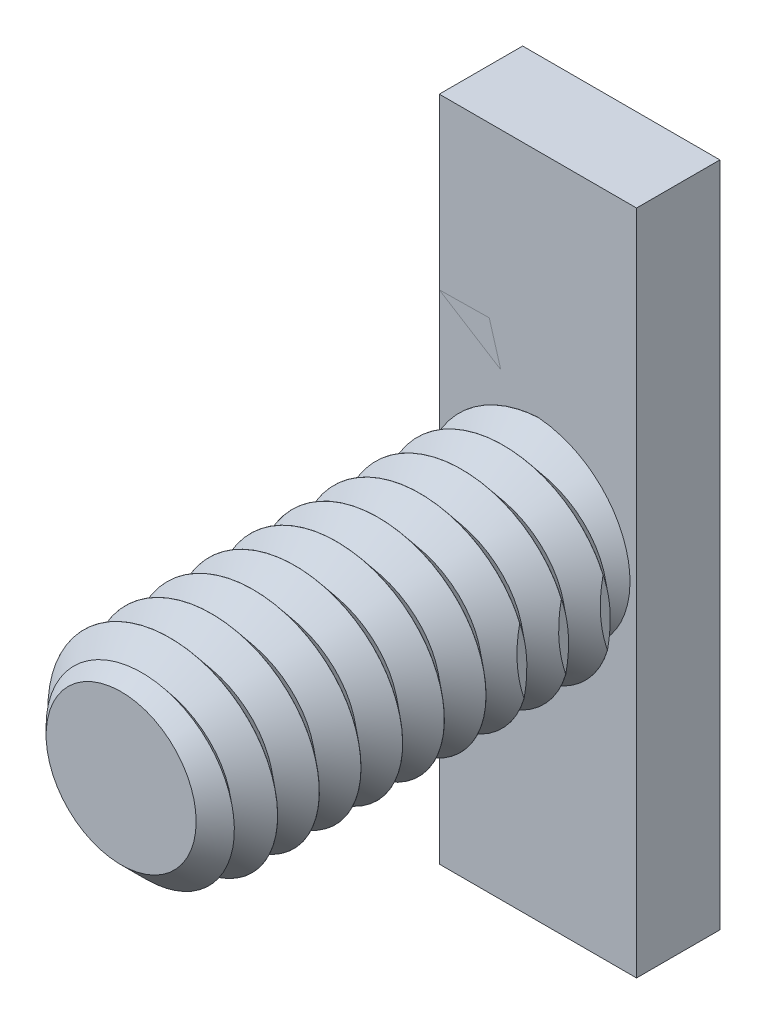
from build123d import *

# Parameters (mm, degrees)
BOSS_EXTRUDE1_DEPTH = 4
SKETCH2_R           = 5
BOSS_EXTRUDE2_DEPTH = 20
CHAMFER1_SIZE       = 1.4
CUT_SWEEP1_PITCH    = 2
BOSS_EXTRUDE3_DEPTH = 4
SKETCH23_W          = 4
SKETCH23_H          = 31.99837251
BOSS_EXTRUDE4_DEPTH = 4.732434
SKETCH26_W          = 9.464868598
SKETCH26_H          = 31.99837251
CUT_EXTRUDE1_DEPTH  = 10


with BuildPart() as part:
    # Sketch1 → Boss-Extrude1 (new body)
    with BuildSketch(Plane.XY):
        Polygon((4.732434299, -7.933309457), (9.236664675, 0.131753596), (4.504230376, 8.065063053), (-4.732434299, 7.933309457), (-9.236664675, -0.131753596), (-4.504230376, -8.065063053), align=None)
    extrude(amount=BOSS_EXTRUDE1_DEPTH)

    # Sketch2 → Boss-Extrude2 (add)
    with BuildSketch(Plane.XY.offset(4)):
        Circle(SKETCH2_R)
    extrude(amount=BOSS_EXTRUDE2_DEPTH)

    # Chamfer1
    chamfer1_edges = [part.edges().sort_by_distance(p)[0] for p in [
        (-5, 0, 24),
    ]]
    chamfer(chamfer1_edges, length=CHAMFER1_SIZE)

    # Cut-Sweep1: the profile of Sketch15 profile screwed along a right-hand helix of 10.5 turns, 10 arcs to a turn; built about Z, then put on its axis
    cut_sweep1_z = Axis((0, 0, 0), (0, 0, 1))
    cut_sweep1_corners = [(3.8, 0, 0), (5.0003, 0, -0.997749375), (5.0003, 0, 0.997749375)]
    with BuildLine(mode=Mode.PRIVATE) as cut_sweep1_profile:
        Line(cut_sweep1_corners[0], cut_sweep1_corners[1])
        Line(cut_sweep1_corners[1], cut_sweep1_corners[2])
        Line(cut_sweep1_corners[2], cut_sweep1_corners[0])
    cut_sweep1_cap = Face(cut_sweep1_profile.wire())
    cut_sweep1_turn_angles = [0, 18, 36, 54, 72, 90, 108, 126, 144, 162, 180, 198, 216, 234, 252, 270, 288, 306, 324, 342, 360]
    cut_sweep1_turn_weights = [1, 0.9510565162951535, 1, 0.9510565162951535, 1, 0.9510565162951535, 1, 0.9510565162951535, 1, 0.9510565162951535, 1, 0.9510565162951535, 1, 0.9510565162951535, 1, 0.9510565162951535, 1, 0.9510565162951535, 1, 0.9510565162951535, 1]
    cut_sweep1_turn_rails = [Edge.make_bspline([Vector(p[0], p[1], 0).rotate(cut_sweep1_z, cut_sweep1_turn_angles[k]) / cut_sweep1_turn_weights[k] + Vector(0, 0, p[2] + CUT_SWEEP1_PITCH * cut_sweep1_turn_angles[k] / 360) for k in range(21)], [0, 0, 0, 1, 1, 2, 2, 3, 3, 4, 4, 5, 5, 6, 6, 7, 7, 8, 8, 9, 9, 10, 10, 10], 2, cut_sweep1_turn_weights) for p in cut_sweep1_corners]
    cut_sweep1_turn_sides = [Face.make_surface_from_curves(cut_sweep1_turn_rails[p[0]], cut_sweep1_turn_rails[p[1]]) for p in [(0, 1), (1, 2), (2, 0)]]
    cut_sweep1_last_angles = [3600, 3618, 3636, 3654, 3672, 3690, 3708, 3726, 3744, 3762, 3780]
    cut_sweep1_last_weights = [1, 0.9510565162951535, 1, 0.9510565162951535, 1, 0.9510565162951535, 1, 0.9510565162951535, 1, 0.9510565162951572, 1]
    cut_sweep1_last_rails = [Edge.make_bspline([Vector(p[0], p[1], 0).rotate(cut_sweep1_z, cut_sweep1_last_angles[k]) / cut_sweep1_last_weights[k] + Vector(0, 0, p[2] + CUT_SWEEP1_PITCH * cut_sweep1_last_angles[k] / 360) for k in range(11)], [0, 0, 0, 1, 1, 2, 2, 3, 3, 4, 4, 5, 5, 5], 2, cut_sweep1_last_weights) for p in cut_sweep1_corners]
    cut_sweep1_last_sides = [Face.make_surface_from_curves(cut_sweep1_last_rails[p[0]], cut_sweep1_last_rails[p[1]]) for p in [(0, 1), (1, 2), (2, 0)]]
    cut_sweep1 = Plane(origin=(0, 0, 24), x_dir=(0, -1, 0), z_dir=(0, 0, -1)) * Solid(Shell([*[p.moved(Location((0, 0, CUT_SWEEP1_PITCH * i))) for i in range(10) for p in cut_sweep1_turn_sides], *cut_sweep1_last_sides, cut_sweep1_cap, cut_sweep1_cap.rotate(cut_sweep1_z, 3780).moved(Location((0, 0, CUT_SWEEP1_PITCH * 3780 / 360)))]))
    add(cut_sweep1, mode=Mode.SUBTRACT)

    # Sketch22 → Boss-Extrude3 (add)
    with BuildSketch(Plane(origin=(0, 0, 0), x_dir=(-1, 0, 0), z_dir=(0, 0, -1))):
        Polygon((-4.732434299, -7.933309457), (4.504230376, -8.065063053), (9.236664675, -0.131753596), (4.732434299, 7.933309457), (-4.504230376, 8.065063053), (-9.236664675, 0.131753596), align=None)
    extrude(amount=-BOSS_EXTRUDE3_DEPTH)

    # Sketch26 → Cut-Extrude1 (cut)
    with BuildSketch(Plane(origin=(0, 0, 0), x_dir=(-1, 0, 0), z_dir=(0, 0, -1))):
        Polygon((-18.271604464, -24.196886448), (-12.165001993, 25.384908803), (24.439911366, 24.810640775), (10.03570608, -20.18194405), align=None)
        with Locations((0, 0.065876798)):
            Rectangle(SKETCH26_W, SKETCH26_H, mode=Mode.SUBTRACT)
    extrude(amount=-CUT_EXTRUDE1_DEPTH, mode=Mode.SUBTRACT)


with BuildPart() as body_2:
    # Sketch23 → Boss-Extrude4 (new body)
    with BuildSketch(Plane(origin=(0, 0, 0), x_dir=(0, 0, -1), z_dir=(1, 0, 0))):
        with Locations((-2, 0.065876798)):
            Rectangle(SKETCH23_W, SKETCH23_H)
    extrude(amount=BOSS_EXTRUDE4_DEPTH)

    # Mirror1: body 2 across plane


with BuildPart() as body_2_1:
    add(body_2.part)
    add(body_2.part.mirror(Plane.ZY))


solid = Compound([part.part, body_2_1.part])
